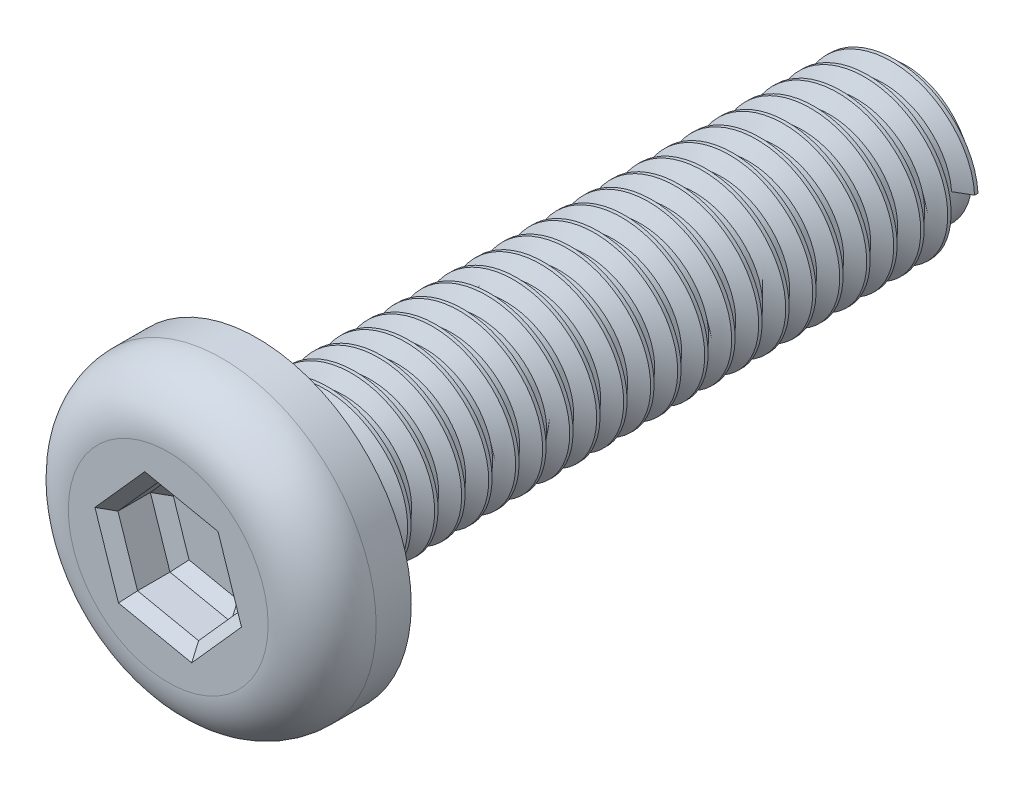
from build123d import *

# Parameters (mm, degrees)
SKETCH_1_R          = 2.85
EXTRUDE_1_DEPTH     = 1.65
SKETCH_2_R          = 1.2295
EXTRUDE_2_DEPTH     = 12
FILLET_1_R          = 1
CUT_EXTRUDE_1_DEPTH = 1
CHAMFER_1_SIZE      = 0.2
THREAD_1_PITCH      = 0.5


with BuildPart() as part:
    # 草图1 → 凸台-拉伸1 (new body)
    with BuildSketch(Plane.XY):
        Circle(SKETCH_1_R)
    extrude(amount=EXTRUDE_1_DEPTH)

    # Sketch 2 → 凸台-拉伸2 (add)
    with BuildSketch(Plane(origin=(0, 0, 0), x_dir=(-1, 0, 0), z_dir=(0, 0, -1))):
        Circle(SKETCH_2_R)
    extrude(amount=EXTRUDE_2_DEPTH)

    # 圆角1
    fillet_1_edges = [part.edges().sort_by_distance(p)[0] for p in [
        (-2.85, 0, 1.65),
    ]]
    fillet(fillet_1_edges, radius=FILLET_1_R)

    # 草图3 → 切除-拉伸1 (cut)
    with BuildSketch(Plane.XY.offset(1.65)):
        Polygon((0.362222341, -1.09641612), (1.130635384, -0.234514311), (0.768413043, 0.861901809), (-0.362222341, 1.09641612), (-1.130635384, 0.234514311), (-0.768413043, -0.861901809), align=None)
    extrude(amount=-CUT_EXTRUDE_1_DEPTH, mode=Mode.SUBTRACT)

    # 倒角1
    chamfer_1_edges = [part.edges().sort_by_distance(p)[0] for p in [
        (-0.203095351, -0.979158965, 0.65),
        (-0.949524213, -0.313693749, 0.65),
        (-0.746428862, 0.665465216, 0.65),
        (0.203095351, 0.979158965, 0.65),
        (0.949524213, 0.313693749, 0.65),
        (0.746428862, -0.665465216, 0.65),
        (-0.203095351, -0.979158965, 1.65),
        (0.746428862, -0.665465216, 1.65),
        (0.949524213, 0.313693749, 1.65),
        (0.203095351, 0.979158965, 1.65),
        (-0.746428862, 0.665465216, 1.65),
        (-0.949524213, -0.313693749, 1.65),
    ]]
    chamfer(chamfer_1_edges, length=CHAMFER_1_SIZE)

    # 螺纹线1: the profile of Sketch 2 2 profile screwed along a right-hand helix of 24 turns, 6 arcs to a turn; built about Z, then put on its axis
    thread_1_z = Axis((0, 0, 0), (0, 0, 1))
    thread_1_corners = [(1.2292, 0, -0.000173205), (1.500132938, 0, 0.156249999), (1.500132938, 0, 0.218749999), (1.2292, 0, 0.375173204)]
    with BuildLine(mode=Mode.PRIVATE) as thread_1_profile:
        Line(thread_1_corners[0], thread_1_corners[1])
        Line(thread_1_corners[1], thread_1_corners[2])
        Line(thread_1_corners[2], thread_1_corners[3])
        Line(thread_1_corners[3], thread_1_corners[0])
    thread_1_cap = Face(thread_1_profile.wire())
    thread_1_turn_angles = [0, 30, 60, 90, 120, 150, 180, 210, 240, 270, 300, 330, 360]
    thread_1_turn_weights = [1, 0.8660254037844387, 1, 0.8660254037844387, 1, 0.8660254037844387, 1, 0.8660254037844387, 1, 0.8660254037844387, 1, 0.8660254037844387, 1]
    thread_1_turn_rails = [Edge.make_bspline([Vector(p[0], p[1], 0).rotate(thread_1_z, thread_1_turn_angles[k]) / thread_1_turn_weights[k] + Vector(0, 0, p[2] + THREAD_1_PITCH * thread_1_turn_angles[k] / 360) for k in range(13)], [0, 0, 0, 1, 1, 2, 2, 3, 3, 4, 4, 5, 5, 6, 6, 6], 2, thread_1_turn_weights) for p in thread_1_corners]
    thread_1_turn_sides = [Face.make_surface_from_curves(thread_1_turn_rails[p[0]], thread_1_turn_rails[p[1]]) for p in [(0, 1), (1, 2), (2, 3), (3, 0)]]
    thread_1 = Plane(origin=(0, 0, -12), x_dir=(1, 0, 0), z_dir=(0, 0, 1)) * Solid(Shell([*[p.moved(Location((0, 0, THREAD_1_PITCH * i))) for i in range(24) for p in thread_1_turn_sides], thread_1_cap, thread_1_cap.rotate(thread_1_z, 8640).moved(Location((0, 0, THREAD_1_PITCH * 8640 / 360)))]))
    add(thread_1)


solid = part.part
